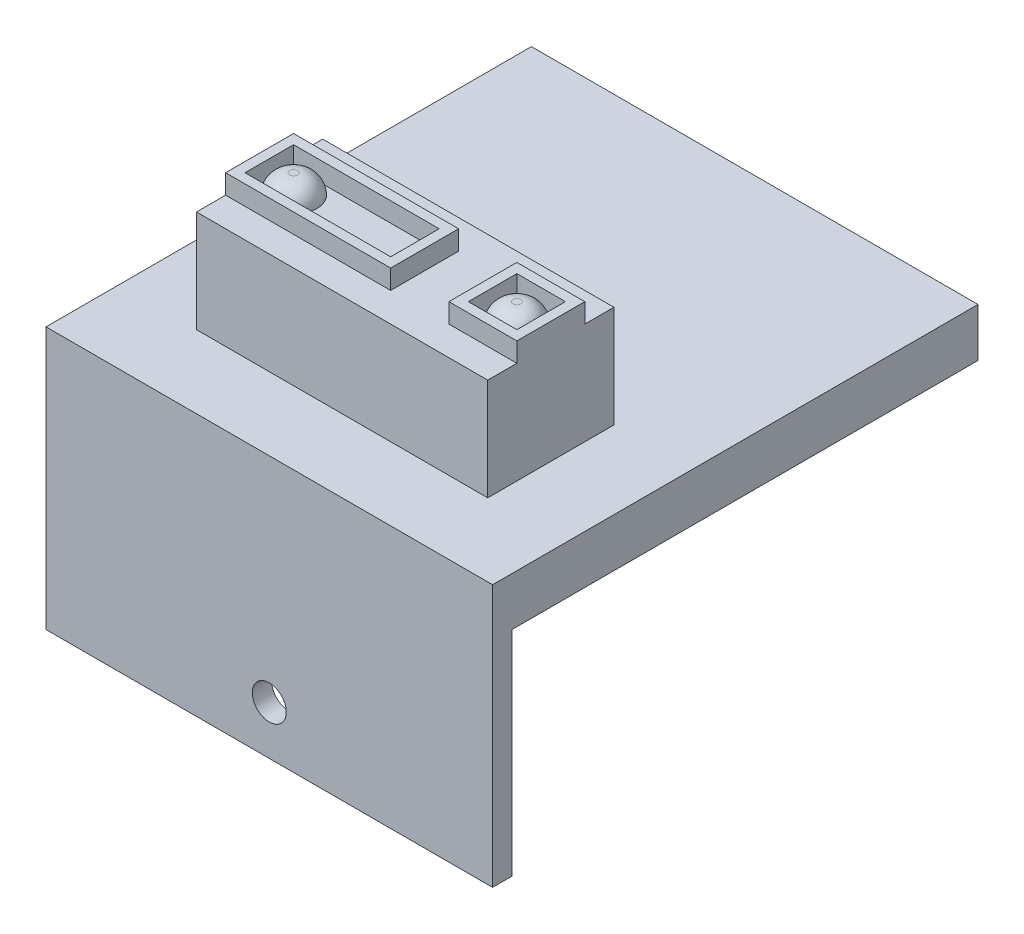
from build123d import *

# Parameters (mm, degrees)
SKETCH1_W           = 46
SKETCH1_H           = 50
BOSS_EXTRUDE1_DEPTH = 5
SKETCH2_W           = 30
SKETCH2_H           = 13
BOSS_EXTRUDE2_DEPTH = 12.5
SKETCH3_W           = 46
SKETCH3_H           = 2
BOSS_EXTRUDE3_DEPTH = 22
SKETCH4_R           = 1.75
CUT_EXTRUDE1_DEPTH  = 22
SKETCH5_W           = 15
SKETCH5_H           = 5
SKETCH5_W_2         = 5
CUT_EXTRUDE2_DEPTH  = 2
SKETCH6_R           = 2.4
BOSS_EXTRUDE6_DEPTH = 2
FILLET1_R           = 2


with BuildPart() as part:
    # Sketch1 → Boss-Extrude1 (new body)
    with BuildSketch(Plane(origin=(0, 0, 0), x_dir=(1, 0, 0), z_dir=(0, 1, 0))):
        with Locations((23, 25)):
            Rectangle(SKETCH1_W, SKETCH1_H)
    extrude(amount=BOSS_EXTRUDE1_DEPTH)

    # Sketch2 → Boss-Extrude2 (add)
    with BuildSketch(Plane(origin=(0, 5, 0), x_dir=(1, 0, 0), z_dir=(0, 1, 0))):
        with Locations((23, 14)):
            Rectangle(SKETCH2_W, SKETCH2_H)
    extrude(amount=BOSS_EXTRUDE2_DEPTH)

    # Sketch3 → Boss-Extrude3 (add)
    with BuildSketch(Plane.XZ):
        with Locations((23, -1)):
            Rectangle(SKETCH3_W, SKETCH3_H)
    extrude(amount=BOSS_EXTRUDE3_DEPTH)

    # Sketch4 → Cut-Extrude1 (cut)
    with BuildSketch(Plane(origin=(0, 0, -2), x_dir=(-1, 0, 0), z_dir=(0, 0, -1))):
        with Locations((-23, -17)):
            Circle(SKETCH4_R)
    extrude(amount=-CUT_EXTRUDE1_DEPTH, mode=Mode.SUBTRACT)

    # Sketch5 → Cut-Extrude2 (cut)
    with BuildSketch(Plane(origin=(0, 17.5, 0), x_dir=(1, 0, 0), z_dir=(0, 1, 0))):
        with Locations((16.5, 14)):
            Rectangle(SKETCH5_W, SKETCH5_H)
        with Locations((34.5, 14)):
            Rectangle(SKETCH5_W_2, SKETCH5_H)
        Polygon((31, 17.5), (31, 10.5), (38, 10.5), (38, 7.5), (8, 7.5), (8, 10.5), (25, 10.5), (25, 17.5), (8, 17.5), (8, 20.5), (38, 20.5), (38, 17.5), align=None)
    extrude(amount=-CUT_EXTRUDE2_DEPTH, mode=Mode.SUBTRACT)

    # Sketch6 → Boss-Extrude6 (add)
    with BuildSketch(Plane(origin=(0, 15.5, 0), x_dir=(1, 0, 0), z_dir=(0, 1, 0))):
        with Locations(Location((11.5, 14, 0), (0, 0, 270))):
            Circle(SKETCH6_R)
        with Locations(Location((34.5, 14, 0), (0, 0, 90))):
            Circle(SKETCH6_R)
    extrude(amount=BOSS_EXTRUDE6_DEPTH)

    # Fillet1
    fillet1_edges = [part.edges().sort_by_distance(p)[0] for p in [
        (11.5, 17.5, -16.4),
        (34.5, 17.5, -11.6),
    ]]
    fillet(fillet1_edges, radius=FILLET1_R - 0.0001)  # a hair under: the kernel refuses the full size


solid = part.part
